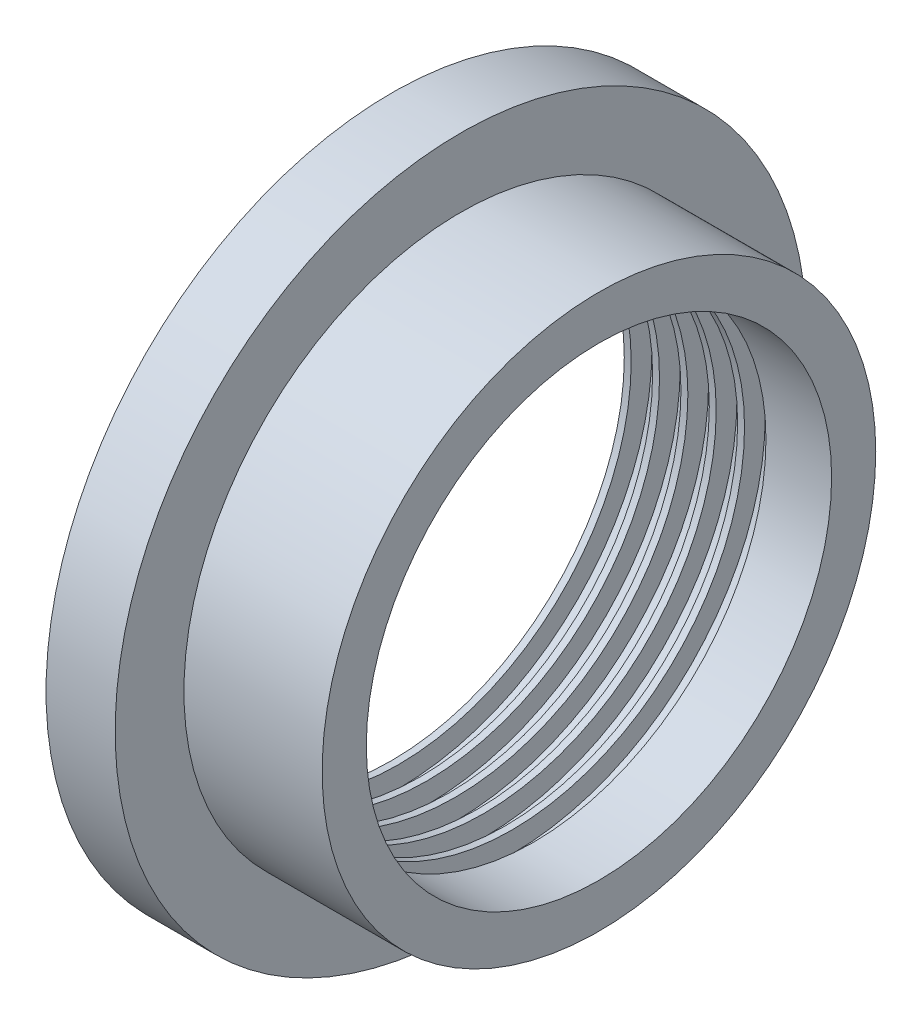
from build123d import *


with BuildPart() as part:
    # Sketch1 → Revolve1 (revolve)
    with BuildSketch(Plane.XY):
        Polygon((-7.62, 12.7), (-7.62, 8.550800018), (-7.366, 8.550800018), (-7.366, 9.312800018), (-6.5786, 9.312800018), (-6.5786, 8.550800018), (-6.3246, 8.550800018), (-6.3246, 9.312800018), (-5.5372, 9.312800018), (-5.5372, 8.550800018), (-5.2832, 8.550800018), (-5.2832, 9.312800018), (-4.4958, 9.312800018), (-4.4958, 8.550800018), (-4.2418, 8.550800018), (-4.2418, 9.312800018), (-3.4544, 9.312800018), (-3.4544, 8.550800018), (-3.2004, 8.550800018), (-3.2004, 9.312800018), (-2.413, 9.312800018), (-2.413, 8.550800018), (0, 8.550800018), (0, 10.1727), (-5.08, 10.1727), (-5.08, 12.7), align=None)
    revolve(axis=Axis((0, 0, 0), (-1, 0, 0)))


solid = part.part
